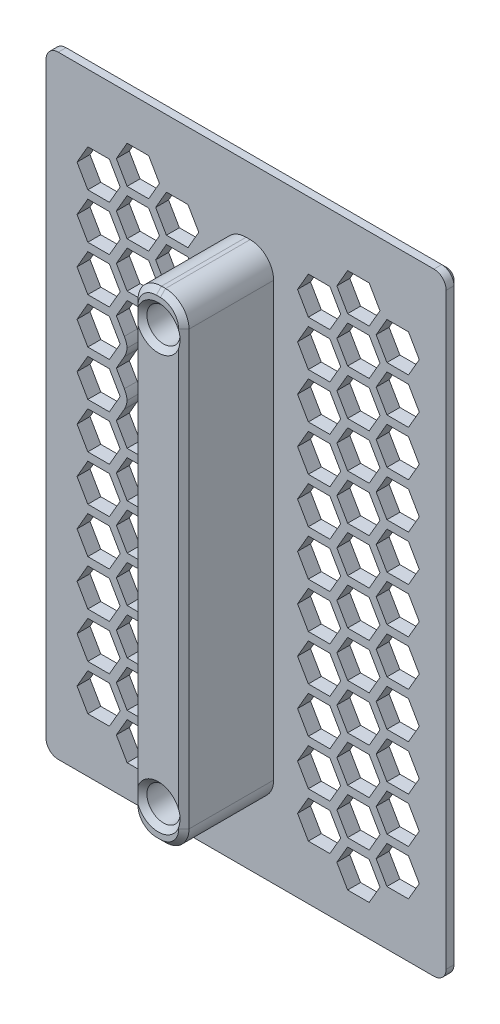
from build123d import *

# Parameters (mm, degrees)
SKETCH1_W           = 49
SKETCH1_H           = 75
BOSS_EXTRUDE1_DEPTH = 1.5875
BOSS_EXTRUDE2_DEPTH = 11
SKETCH3_R           = 2.032
CUT_EXTRUDE1_DEPTH  = 9.525
FILLET1_R           = 1.5
CUT_EXTRUDE2_DEPTH  = 1.5875
CHAMFER1_SIZE       = 0.635
FILLET2_R           = 2.54


with BuildPart() as part:
    # Sketch1 → Boss-Extrude1 (new body)
    with BuildSketch(Plane.XY):
        Rectangle(SKETCH1_W, SKETCH1_H)
    extrude(amount=BOSS_EXTRUDE1_DEPTH)

    # Sketch2 → Boss-Extrude2 (add)
    with BuildSketch(Plane.XY.offset(1.5875)):
        with BuildLine():
            Line((3.373, -26.5), (3.373, 26.5))
            ThreePointArc((3.373, 26.5), (2.531517782, 28.531517782), (0.5, 29.373))
            Line((0.5, 29.373), (0, 29.373))
            ThreePointArc((0, 29.373), (-2.031517782, 28.531517782), (-2.873, 26.5))
            Line((-2.873, 26.5), (-2.873, -26.5))
            ThreePointArc((-2.873, -26.5), (-2.031517782, -28.531517782), (0, -29.373))
            Line((0, -29.373), (0.5, -29.373))
            ThreePointArc((0.5, -29.373), (2.531517782, -28.531517782), (3.373, -26.5))
        make_face()
    extrude(amount=BOSS_EXTRUDE2_DEPTH)

    # Sketch3 → Cut-Extrude1 (cut)
    with BuildSketch(Plane.XY.offset(12.5875)):
        with Locations((0.25, 25.4)):
            Circle(SKETCH3_R)
        with Locations((0.25, -25.4)):
            Circle(SKETCH3_R)
    extrude(amount=-CUT_EXTRUDE1_DEPTH, mode=Mode.SUBTRACT)

    # Fillet1
    fillet1_edges = [part.edges().sort_by_distance(p)[0] for p in [
        (-24.5, 37.5, 0.79375),
        (24.5, 37.5, 0.79375),
        (24.5, -37.5, 0.79375),
        (-24.5, -37.5, 0.79375),
    ]]
    fillet(fillet1_edges, radius=FILLET1_R)

    # Sketch4 → Cut-Extrude2 (cut)
    with BuildSketch(Plane(origin=(0, 0, 0), x_dir=(-1, 0, 0), z_dir=(0, 0, -1))):
        Polygon((-16.389645431, -31.346033363), (-15.069822715, -33.632033363), (-12.430177285, -33.632033363), (-11.110354569, -31.346033363), (-12.430177285, -29.060033363), (-15.069822715, -29.060033363), align=None)
        Polygon((-21.201499081, -28.567908363), (-19.881676365, -30.853908363), (-17.242030934, -30.853908363), (-15.922208219, -28.567908363), (-17.242030934, -26.281908363), (-19.881676365, -26.281908363), align=None)
        Polygon((-10.257969066, -30.853908363), (-7.618323635, -30.853908363), (-6.298500919, -28.567908363), (-7.618323635, -26.281908363), (-10.257969066, -26.281908363), (-11.577791781, -28.567908363), align=None)
        Polygon((-10.257969066, -20.725658363), (-11.577791781, -23.011658363), (-10.257969066, -25.297658363), (-7.618323635, -25.297658363), (-6.298500919, -23.011658363), (-7.618323635, -20.725658363), align=None)
        Polygon((-11.110354569, -25.789783363), (-12.430177285, -23.503783363), (-15.069822715, -23.503783363), (-16.389645431, -25.789783363), (-15.069822715, -28.075783363), (-12.430177285, -28.075783363), align=None)
        Polygon((-17.242030934, -25.297658363), (-15.922208219, -23.011658363), (-17.242030934, -20.725658363), (-19.881676365, -20.725658363), (-21.201499081, -23.011658363), (-19.881676365, -25.297658363), align=None)
        Polygon((-10.257969066, -15.169408363), (-11.577791781, -17.455408363), (-10.257969066, -19.741408363), (-7.618323635, -19.741408363), (-6.298500919, -17.455408363), (-7.618323635, -15.169408363), align=None)
        Polygon((-11.110354569, -20.233533363), (-12.430177285, -17.947533363), (-15.069822715, -17.947533363), (-16.389645431, -20.233533363), (-15.069822715, -22.519533363), (-12.430177285, -22.519533363), align=None)
        Polygon((-17.242030934, -19.741408363), (-15.922208219, -17.455408363), (-17.242030934, -15.169408363), (-19.881676365, -15.169408363), (-21.201499081, -17.455408363), (-19.881676365, -19.741408363), align=None)
        Polygon((-10.257969066, -9.613158363), (-11.577791781, -11.899158363), (-10.257969066, -14.185158363), (-7.618323635, -14.185158363), (-6.298500919, -11.899158363), (-7.618323635, -9.613158363), align=None)
        Polygon((-11.110354569, -14.677283363), (-12.430177285, -12.391283363), (-15.069822715, -12.391283363), (-16.389645431, -14.677283363), (-15.069822715, -16.963283363), (-12.430177285, -16.963283363), align=None)
        Polygon((-17.242030934, -14.185158363), (-15.922208219, -11.899158363), (-17.242030934, -9.613158363), (-19.881676365, -9.613158363), (-21.201499081, -11.899158363), (-19.881676365, -14.185158363), align=None)
        Polygon((-10.257969066, -4.056908363), (-11.577791781, -6.342908363), (-10.257969066, -8.628908363), (-7.618323635, -8.628908363), (-6.298500919, -6.342908363), (-7.618323635, -4.056908363), align=None)
        Polygon((-11.110354569, -9.121033363), (-12.430177285, -6.835033363), (-15.069822715, -6.835033363), (-16.389645431, -9.121033363), (-15.069822715, -11.407033363), (-12.430177285, -11.407033363), align=None)
        Polygon((-17.242030934, -8.628908363), (-15.922208219, -6.342908363), (-17.242030934, -4.056908363), (-19.881676365, -4.056908363), (-21.201499081, -6.342908363), (-19.881676365, -8.628908363), align=None)
        Polygon((-10.257969066, 1.499341637), (-11.577791781, -0.786658363), (-10.257969066, -3.072658363), (-7.618323635, -3.072658363), (-6.298500919, -0.786658363), (-7.618323635, 1.499341637), align=None)
        Polygon((-11.110354569, -3.564783363), (-12.430177285, -1.278783363), (-15.069822715, -1.278783363), (-16.389645431, -3.564783363), (-15.069822715, -5.850783363), (-12.430177285, -5.850783363), align=None)
        Polygon((-17.242030934, -3.072658363), (-15.922208219, -0.786658363), (-17.242030934, 1.499341637), (-19.881676365, 1.499341637), (-21.201499081, -0.786658363), (-19.881676365, -3.072658363), align=None)
        Polygon((-10.257969066, 7.055591637), (-11.577791781, 4.769591637), (-10.257969066, 2.483591637), (-7.618323635, 2.483591637), (-6.298500919, 4.769591637), (-7.618323635, 7.055591637), align=None)
        Polygon((-11.110354569, 1.991466637), (-12.430177285, 4.277466637), (-15.069822715, 4.277466637), (-16.389645431, 1.991466637), (-15.069822715, -0.294533363), (-12.430177285, -0.294533363), align=None)
        Polygon((-17.242030934, 2.483591637), (-15.922208219, 4.769591637), (-17.242030934, 7.055591637), (-19.881676365, 7.055591637), (-21.201499081, 4.769591637), (-19.881676365, 2.483591637), align=None)
        Polygon((-10.257969066, 12.611841637), (-11.577791781, 10.325841637), (-10.257969066, 8.039841637), (-7.618323635, 8.039841637), (-6.298500919, 10.325841637), (-7.618323635, 12.611841637), align=None)
        Polygon((-11.110354569, 7.547716637), (-12.430177285, 9.833716637), (-15.069822715, 9.833716637), (-16.389645431, 7.547716637), (-15.069822715, 5.261716637), (-12.430177285, 5.261716637), align=None)
        Polygon((-17.242030934, 8.039841637), (-15.922208219, 10.325841637), (-17.242030934, 12.611841637), (-19.881676365, 12.611841637), (-21.201499081, 10.325841637), (-19.881676365, 8.039841637), align=None)
        Polygon((-10.257969066, 18.168091637), (-11.577791781, 15.882091637), (-10.257969066, 13.596091637), (-7.618323635, 13.596091637), (-6.298500919, 15.882091637), (-7.618323635, 18.168091637), align=None)
        Polygon((-11.110354569, 13.103966637), (-12.430177285, 15.389966637), (-15.069822715, 15.389966637), (-16.389645431, 13.103966637), (-15.069822715, 10.817966637), (-12.430177285, 10.817966637), align=None)
        Polygon((-17.242030934, 13.596091637), (-15.922208219, 15.882091637), (-17.242030934, 18.168091637), (-19.881676365, 18.168091637), (-21.201499081, 15.882091637), (-19.881676365, 13.596091637), align=None)
        Polygon((-10.257969066, 23.724341637), (-11.577791781, 21.438341637), (-10.257969066, 19.152341637), (-7.618323635, 19.152341637), (-6.298500919, 21.438341637), (-7.618323635, 23.724341637), align=None)
        Polygon((-11.110354569, 18.660216637), (-12.430177285, 20.946216637), (-15.069822715, 20.946216637), (-16.389645431, 18.660216637), (-15.069822715, 16.374216637), (-12.430177285, 16.374216637), align=None)
        Polygon((-17.242030934, 19.152341637), (-15.922208219, 21.438341637), (-17.242030934, 23.724341637), (-19.881676365, 23.724341637), (-21.201499081, 21.438341637), (-19.881676365, 19.152341637), align=None)
        Polygon((11.930177285, 5.261716637), (11.930177285, 4.277466637), (10.610354569, 1.991466637), (11.930177285, -0.294533363), (14.569822715, -0.294533363), (15.889645431, 1.991466637), (14.569822715, 4.277466637), (14.569822715, 5.261716637), (15.889645431, 7.547716637), (14.569822715, 9.833716637), (14.569822715, 10.817966637), (15.889645431, 13.103966637), (14.569822715, 15.389966637), (11.930177285, 15.389966637), (10.610354569, 13.103966637), (11.930177285, 10.817966637), (11.930177285, 9.833716637), (10.610354569, 7.547716637), align=None)
        Polygon((-10.257969066, 29.280591637), (-11.577791781, 26.994591637), (-10.257969066, 24.708591637), (-7.618323635, 24.708591637), (-6.298500919, 26.994591637), (-7.618323635, 29.280591637), align=None)
        Polygon((-11.110354569, 24.216466637), (-12.430177285, 26.502466637), (-15.069822715, 26.502466637), (-16.389645431, 24.216466637), (-15.069822715, 21.930466637), (-12.430177285, 21.930466637), align=None)
        Polygon((-17.242030934, 24.708591637), (-15.922208219, 26.994591637), (-17.242030934, 29.280591637), (-19.881676365, 29.280591637), (-21.201499081, 26.994591637), (-19.881676365, 24.708591637), align=None)
        Polygon((-11.110354569, 29.772716637), (-12.430177285, 32.058716637), (-15.069822715, 32.058716637), (-16.389645431, 29.772716637), (-15.069822715, 27.486716637), (-12.430177285, 27.486716637), align=None)
        Polygon((11.930177285, 27.486716637), (10.610354569, 29.772716637), (11.930177285, 32.058716637), (14.569822715, 32.058716637), (15.889645431, 29.772716637), (14.569822715, 27.486716637), align=None)
        Polygon((19.381676365, 24.708591637), (16.742030934, 24.708591637), (15.422208219, 26.994591637), (16.742030934, 29.280591637), (19.381676365, 29.280591637), (20.701499081, 26.994591637), align=None)
        Polygon((11.930177285, 21.930466637), (10.610354569, 24.216466637), (11.930177285, 26.502466637), (14.569822715, 26.502466637), (15.889645431, 24.216466637), (14.569822715, 21.930466637), align=None)
        Polygon((11.077791781, 26.994591637), (9.757969066, 24.708591637), (7.118323635, 24.708591637), (5.798500919, 26.994591637), (7.118323635, 29.280591637), (9.757969066, 29.280591637), align=None)
        Polygon((19.381676365, 19.152341637), (16.742030934, 19.152341637), (15.422208219, 21.438341637), (16.742030934, 23.724341637), (19.381676365, 23.724341637), (20.701499081, 21.438341637), align=None)
        Polygon((11.930177285, 16.374216637), (10.610354569, 18.660216637), (11.930177285, 20.946216637), (14.569822715, 20.946216637), (15.889645431, 18.660216637), (14.569822715, 16.374216637), align=None)
        Polygon((11.077791781, 21.438341637), (9.757969066, 19.152341637), (7.118323635, 19.152341637), (5.798500919, 21.438341637), (7.118323635, 23.724341637), (9.757969066, 23.724341637), align=None)
        Polygon((19.381676365, 13.596091637), (16.742030934, 13.596091637), (15.422208219, 15.882091637), (16.742030934, 18.168091637), (19.381676365, 18.168091637), (20.701499081, 15.882091637), align=None)
        Polygon((11.077791781, 15.882091637), (9.757969066, 13.596091637), (7.118323635, 13.596091637), (5.798500919, 15.882091637), (7.118323635, 18.168091637), (9.757969066, 18.168091637), align=None)
        Polygon((19.381676365, 8.039841637), (16.742030934, 8.039841637), (15.422208219, 10.325841637), (16.742030934, 12.611841637), (19.381676365, 12.611841637), (20.701499081, 10.325841637), align=None)
        Polygon((11.077791781, 10.325841637), (9.757969066, 8.039841637), (7.118323635, 8.039841637), (5.798500919, 10.325841637), (7.118323635, 12.611841637), (9.757969066, 12.611841637), align=None)
        Polygon((19.381676365, 2.483591637), (16.742030934, 2.483591637), (15.422208219, 4.769591637), (16.742030934, 7.055591637), (19.381676365, 7.055591637), (20.701499081, 4.769591637), align=None)
        Polygon((11.077791781, 4.769591637), (9.757969066, 2.483591637), (7.118323635, 2.483591637), (5.798500919, 4.769591637), (7.118323635, 7.055591637), (9.757969066, 7.055591637), align=None)
        Polygon((19.381676365, -3.072658363), (16.742030934, -3.072658363), (15.422208219, -0.786658363), (16.742030934, 1.499341637), (19.381676365, 1.499341637), (20.701499081, -0.786658363), align=None)
        Polygon((11.930177285, -5.850783363), (10.610354569, -3.564783363), (11.930177285, -1.278783363), (14.569822715, -1.278783363), (15.889645431, -3.564783363), (14.569822715, -5.850783363), align=None)
        Polygon((11.077791781, -0.786658363), (9.757969066, -3.072658363), (7.118323635, -3.072658363), (5.798500919, -0.786658363), (7.118323635, 1.499341637), (9.757969066, 1.499341637), align=None)
        Polygon((19.381676365, -8.628908363), (16.742030934, -8.628908363), (15.422208219, -6.342908363), (16.742030934, -4.056908363), (19.381676365, -4.056908363), (20.701499081, -6.342908363), align=None)
        Polygon((11.930177285, -11.407033363), (10.610354569, -9.121033363), (11.930177285, -6.835033363), (14.569822715, -6.835033363), (15.889645431, -9.121033363), (14.569822715, -11.407033363), align=None)
        Polygon((11.077791781, -6.342908363), (9.757969066, -8.628908363), (7.118323635, -8.628908363), (5.798500919, -6.342908363), (7.118323635, -4.056908363), (9.757969066, -4.056908363), align=None)
        Polygon((19.381676365, -14.185158363), (16.742030934, -14.185158363), (15.422208219, -11.899158363), (16.742030934, -9.613158363), (19.381676365, -9.613158363), (20.701499081, -11.899158363), align=None)
        Polygon((11.930177285, -16.963283363), (10.610354569, -14.677283363), (11.930177285, -12.391283363), (14.569822715, -12.391283363), (15.889645431, -14.677283363), (14.569822715, -16.963283363), align=None)
        Polygon((11.077791781, -11.899158363), (9.757969066, -14.185158363), (7.118323635, -14.185158363), (5.798500919, -11.899158363), (7.118323635, -9.613158363), (9.757969066, -9.613158363), align=None)
        Polygon((19.381676365, -19.741408363), (16.742030934, -19.741408363), (15.422208219, -17.455408363), (16.742030934, -15.169408363), (19.381676365, -15.169408363), (20.701499081, -17.455408363), align=None)
        Polygon((11.930177285, -22.519533363), (10.610354569, -20.233533363), (11.930177285, -17.947533363), (14.569822715, -17.947533363), (15.889645431, -20.233533363), (14.569822715, -22.519533363), align=None)
        Polygon((11.077791781, -17.455408363), (9.757969066, -19.741408363), (7.118323635, -19.741408363), (5.798500919, -17.455408363), (7.118323635, -15.169408363), (9.757969066, -15.169408363), align=None)
        Polygon((19.381676365, -25.297658363), (16.742030934, -25.297658363), (15.422208219, -23.011658363), (16.742030934, -20.725658363), (19.381676365, -20.725658363), (20.701499081, -23.011658363), align=None)
        Polygon((11.930177285, -28.075783363), (10.610354569, -25.789783363), (11.930177285, -23.503783363), (14.569822715, -23.503783363), (15.889645431, -25.789783363), (14.569822715, -28.075783363), align=None)
        Polygon((11.077791781, -23.011658363), (9.757969066, -25.297658363), (7.118323635, -25.297658363), (5.798500919, -23.011658363), (7.118323635, -20.725658363), (9.757969066, -20.725658363), align=None)
        Polygon((11.077791781, -28.567908363), (9.757969066, -30.853908363), (7.118323635, -30.853908363), (5.798500919, -28.567908363), (7.118323635, -26.281908363), (9.757969066, -26.281908363), align=None)
        Polygon((19.381676365, -26.281908363), (20.701499081, -28.567908363), (19.381676365, -30.853908363), (16.742030934, -30.853908363), (15.422208219, -28.567908363), (16.742030934, -26.281908363), align=None)
        Polygon((14.569822715, -29.060033363), (15.889645431, -31.346033363), (14.569822715, -33.632033363), (11.930177285, -33.632033363), (10.610354569, -31.346033363), (11.930177285, -29.060033363), align=None)
    extrude(amount=-CUT_EXTRUDE2_DEPTH, mode=Mode.SUBTRACT)

    # Chamfer1
    # the kernel refuses this chamfer: 0.635 mm, written as the material it takes off along each edge
    with BuildSketch(Plane(origin=(0.5, -26.5, 12.5875), x_dir=(0, -1, 0), z_dir=(-1, 0, 0))) as chamfer1_piece_1:
        Polygon((2.873, -CHAMFER1_SIZE), (2.873 - CHAMFER1_SIZE, 0), (2.873, 0), align=None)
    revolve(axis=Axis((0.5, -26.5, 12.5875), (0, 0, 1)), revolution_arc=90, mode=Mode.SUBTRACT)
    with BuildSketch(Plane(origin=(0, -29.373, 12.5875), x_dir=(0, -0.02749587661058455, -0.9996219169112968), z_dir=(1, 0, 0)), Plane(origin=(0.5, 29.373, 12.5875), x_dir=(0, 0.02749587661058455, -0.9996219169112968), z_dir=(-1, 0, 0))) as chamfer1_piece_2:
        Polygon((CHAMFER1_SIZE * 0.999621916911, CHAMFER1_SIZE * 0.0274958766106), (-CHAMFER1_SIZE * 0.0274958766106, CHAMFER1_SIZE * 0.999621916911), (0, 0), align=None)
    extrude(amount=0.5, mode=Mode.SUBTRACT)
    with BuildSketch(Plane(origin=(0, -26.5, 12.5875), x_dir=(-1, 0, 0), z_dir=(0, 1, 0))) as chamfer1_piece_3:
        Polygon((2.873, -CHAMFER1_SIZE), (2.873 - CHAMFER1_SIZE, 0), (2.873, 0), align=None)
    revolve(axis=Axis((0, -26.5, 12.5875), (0, 0, 1)), revolution_arc=90, mode=Mode.SUBTRACT)
    with BuildSketch(Plane(origin=(-2.873, 26.5, 12.5875), x_dir=(-0.02749587661058659, 0, -0.9996219169112968), z_dir=(0, -1, 0)), Plane(origin=(3.373, -26.5, 12.5875), x_dir=(0.02749587661058659, 0, -0.9996219169112968), z_dir=(0, 1, 0))) as chamfer1_piece_4:
        Polygon((CHAMFER1_SIZE * 0.999621916911, CHAMFER1_SIZE * 0.0274958766106), (-CHAMFER1_SIZE * 0.0274958766106, CHAMFER1_SIZE * 0.999621916911), (0, 0), align=None)
    extrude(amount=53, mode=Mode.SUBTRACT)
    with BuildSketch(Plane(origin=(0, 26.5, 12.5875), x_dir=(0, 1, 0), z_dir=(1, 0, 0))) as chamfer1_piece_5:
        Polygon((2.873, -CHAMFER1_SIZE), (2.873 - CHAMFER1_SIZE, 0), (2.873, 0), align=None)
    revolve(axis=Axis((0, 26.5, 12.5875), (0, 0, 1)), revolution_arc=90, mode=Mode.SUBTRACT)
    with BuildSketch(Plane(origin=(0.5, 26.5, 12.5875), x_dir=(1, 0, 0), z_dir=(0, -1, 0))) as chamfer1_piece_6:
        Polygon((2.873, -CHAMFER1_SIZE), (2.873 - CHAMFER1_SIZE, 0), (2.873, 0), align=None)
    revolve(axis=Axis((0.5, 26.5, 12.5875), (0, 0, 1)), revolution_arc=90, mode=Mode.SUBTRACT)
    with BuildSketch(Plane(origin=(0.25, 25.4, 12.5875), x_dir=(1, 0, 0), z_dir=(0, -1, 0))) as chamfer1_piece_7:
        Polygon((2.032 + CHAMFER1_SIZE, 0), (2.032, -CHAMFER1_SIZE), (2.032, 0), align=None)
    revolve(axis=Axis((0.25, 25.4, 12.5875), (0, 0, 1)), mode=Mode.SUBTRACT)
    with BuildSketch(Plane(origin=(0.25, -25.4, 12.5875), x_dir=(1, 0, 0), z_dir=(0, -1, 0))) as chamfer1_piece_8:
        Polygon((2.032 + CHAMFER1_SIZE, 0), (2.032, -CHAMFER1_SIZE), (2.032, 0), align=None)
    revolve(axis=Axis((0.25, -25.4, 12.5875), (0, 0, 1)), mode=Mode.SUBTRACT)
    with BuildSketch(Plane(origin=(24.5, 36, 0), x_dir=(-0.9996219169112968, 0, -0.027495876610586324), z_dir=(0, -1, 0)), Plane(origin=(-24.5, -36, 0), x_dir=(0.9996219169112968, 0, -0.027495876610586324), z_dir=(0, 1, 0))) as chamfer1_piece_9:
        Polygon((CHAMFER1_SIZE * 0.999621916911, -CHAMFER1_SIZE * 0.0274958766106), (-CHAMFER1_SIZE * 0.0274958766106, -CHAMFER1_SIZE * 0.999621916911), (0, 0), align=None)
    extrude(amount=72, mode=Mode.SUBTRACT)
    with BuildSketch(Plane(origin=(-23, 37.5, 0), x_dir=(0, -0.9996219169112968, -0.027495876610586403), z_dir=(1, 0, 0))) as chamfer1_piece_10:
        Polygon((CHAMFER1_SIZE * 0.999621916911, -CHAMFER1_SIZE * 0.0274958766106), (-CHAMFER1_SIZE * 0.0274958766106, -CHAMFER1_SIZE * 0.999621916911), (0, 0), align=None)
    extrude(amount=46, mode=Mode.SUBTRACT)
    with BuildSketch(Plane(origin=(23, -37.5, 0), x_dir=(0, -0.027495876610589998, 0.9996219169112966), z_dir=(-1, 0, 0))) as chamfer1_piece_11:
        Polygon((CHAMFER1_SIZE * 0.999621916911, CHAMFER1_SIZE * 0.0274958766106), (-CHAMFER1_SIZE * 0.0274958766106, CHAMFER1_SIZE * 0.999621916911), (0, 0), align=None)
    extrude(amount=46, mode=Mode.SUBTRACT)
    with BuildSketch(Plane(origin=(23, 36, 0), x_dir=(1, 0, 0), z_dir=(0, -1, 0))) as chamfer1_piece_12:
        Polygon((1.5 - CHAMFER1_SIZE, 0), (1.5, CHAMFER1_SIZE), (1.5, 0), align=None)
    revolve(axis=Axis((23, 36, 0), (0, 0, 1)), revolution_arc=90, mode=Mode.SUBTRACT)
    with BuildSketch(Plane(origin=(-23, 36, 0), x_dir=(-1, 0, 0), z_dir=(0, -1, 0))) as chamfer1_piece_13:
        Polygon((1.5 - CHAMFER1_SIZE, 0), (1.5, -CHAMFER1_SIZE), (1.5, 0), align=None)
    revolve(axis=Axis((-23, 36, 0), (0, 0, -1)), revolution_arc=90, mode=Mode.SUBTRACT)
    with BuildSketch(Plane(origin=(-23, -36, 0), x_dir=(0, -1, 0), z_dir=(1, 0, 0))) as chamfer1_piece_14:
        Polygon((1.5 - CHAMFER1_SIZE, 0), (1.5, -CHAMFER1_SIZE), (1.5, 0), align=None)
    revolve(axis=Axis((-23, -36, 0), (0, 0, -1)), revolution_arc=90, mode=Mode.SUBTRACT)
    with BuildSketch(Plane(origin=(23, -36, 0), x_dir=(0, -1, 0), z_dir=(-1, 0, 0))) as chamfer1_piece_15:
        Polygon((1.5 - CHAMFER1_SIZE, 0), (1.5, CHAMFER1_SIZE), (1.5, 0), align=None)
    revolve(axis=Axis((23, -36, 0), (0, 0, 1)), revolution_arc=90, mode=Mode.SUBTRACT)

    # Fillet2
    # the kernel refuses this fillet: 2.54 mm, written as the material it takes off along each edge
    with BuildSketch(Plane(origin=(-14.569822715, 5.261716637, -1.701477372), x_dir=(0, -1, 0), z_dir=(0, 0, 1)), Plane(origin=(-14.569822715, 4.277466637, -1.701477372), x_dir=(-0.4999999999999986, -0.8660254037844395, 0), z_dir=(0, 0, 1)), Plane(origin=(-11.930177285, 4.277466637, -1.701477372), x_dir=(0, 1, 0), z_dir=(0, 0, 1)), Plane(origin=(-14.569822715, 9.833716637, -1.701477372), x_dir=(-0.500000000000022, -0.8660254037844259, 0), z_dir=(0, 0, 1)), Plane(origin=(-14.569822715, 10.817966637, -1.701477372), x_dir=(0, -1, 0), z_dir=(0, 0, 1)), Plane(origin=(-11.930177285, 10.817966637, -1.701477372), x_dir=(0.49999999999999145, 0.8660254037844435, 0), z_dir=(0, 0, 1)), Plane(origin=(-11.930177285, 9.833716637, -1.701477372), x_dir=(0, 1, 0), z_dir=(0, 0, 1))) as fillet2_piece_1:
        with BuildLine():
            CenterArc((FILLET2_R * 0.267949192431, -FILLET2_R), FILLET2_R, 90, 30)
            Line((-FILLET2_R * 0.232050807569, -FILLET2_R * 0.133974596216), (0, 0))
            Line((0, 0), (FILLET2_R * 0.267949192431, 0))
        make_face()
    extrude(amount=4.990454744, mode=Mode.SUBTRACT)
    with BuildSketch(Plane(origin=(-11.930177285, 5.261716637, -1.701477372), x_dir=(0, -1, 0), z_dir=(0, 0, 1))) as fillet2_piece_2:
        with BuildLine():
            CenterArc((FILLET2_R * 0.267949192431, FILLET2_R), FILLET2_R, 240, 30)
            Line((-FILLET2_R * 0.232050807569, FILLET2_R * 0.133974596216), (0, 0))
            Line((0, 0), (FILLET2_R * 0.267949192431, 0))
        make_face()
    extrude(amount=4.990454744, mode=Mode.SUBTRACT)


solid = part.part
